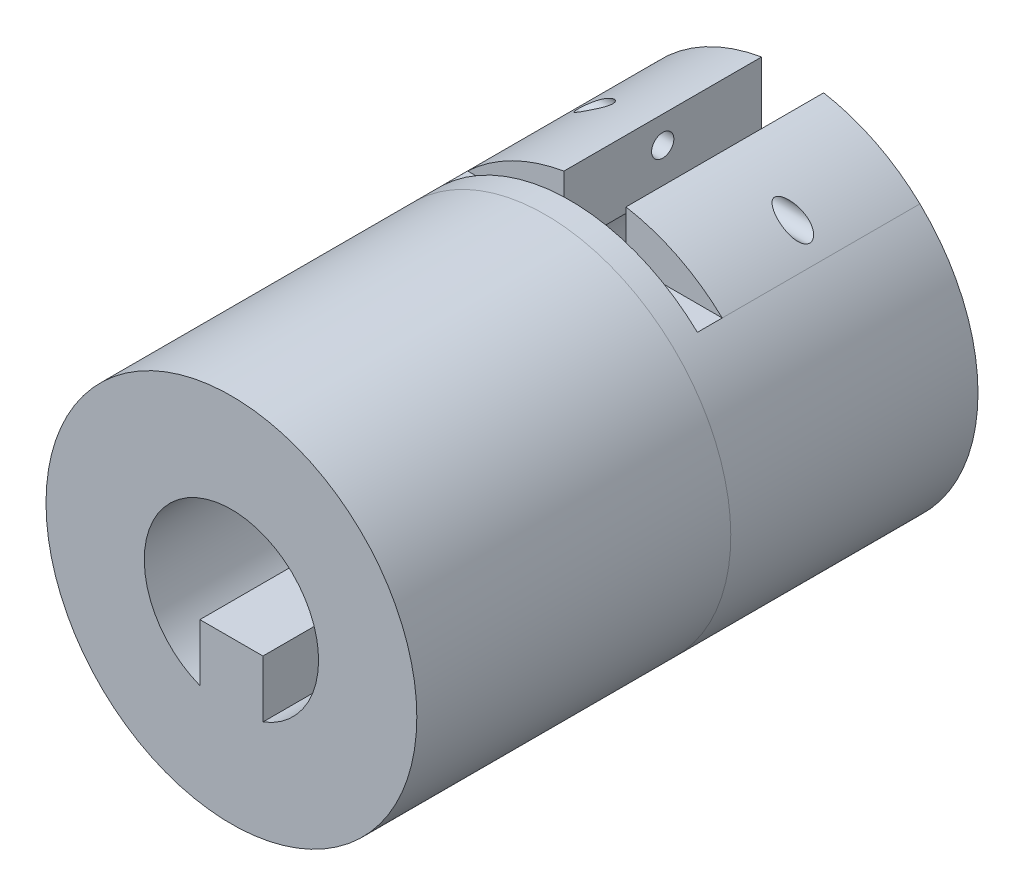
from build123d import *

# Parameters (mm, degrees)
SKETCH1_R               = 15
BOSS_EXTRUDE2_DEPTH     = 25.4
SKETCH11_R              = 15.000115832
BOSS_EXTRUDE3_DEPTH     = 2
BOSS_EXTRUDE4_DEPTH     = 18
SKETCH13_W              = 30.000231663
SKETCH13_H              = 2.007767584
CUT_EXTRUDE1_DEPTH      = 22
CUT_EXTRUDE2_DEPTH      = 40.263306431
CUT_EXTRUDE2_DEPTH_BACK = 40.263306431
SKETCH14_R              = 0.9


with BuildPart() as part:
    # Sketch1 → Boss-Extrude2 (new body)
    with BuildSketch(Plane.XY):
        with Locations((-0.013850499, -10.904093226)):
            Circle(SKETCH1_R)
        with BuildLine():
            Line((2.536149501, -12.854093226), (-2.563850499, -12.854093226))
            Line((-2.563850499, -12.854093226), (-2.563850499, -17.476763916))
            ThreePointArc((-2.563850499, -17.476763916), (-0.013850499, -3.854093226), (2.536149501, -17.476763916))
            Line((2.536149501, -17.476763916), (2.536149501, -12.854093226))
        make_face(mode=Mode.SUBTRACT)
    extrude(amount=BOSS_EXTRUDE2_DEPTH)

    # Sketch11 → Boss-Extrude3 (add)
    with BuildSketch(Plane(origin=(0, 0, 0), x_dir=(-1, 0, 0), z_dir=(0, 0, -1))):
        with Locations((0.013850499, -10.904093226)):
            Circle(SKETCH11_R)
    extrude(amount=BOSS_EXTRUDE3_DEPTH)

    # Sketch12 → Boss-Extrude4 (add)
    with BuildSketch(Plane(origin=(0, 0, -2), x_dir=(-1, 0, 0), z_dir=(0, 0, -1))):
        with BuildLine():
            Line((2.524923405, 3.884347795), (2.524923405, -1.586528477))
            ThreePointArc((2.524923405, -1.586528477), (0.013850499, -20.554093226), (-2.497222408, -1.586528477))
            Line((-2.497222408, -1.586528477), (-2.497222408, 3.884347795))
            ThreePointArc((-2.497222408, 3.884347795), (-9.664400648, -22.364238501), (15.01396633, -10.904093226))
            ThreePointArc((15.01396633, -10.904093226), (11.473995773, -1.22584208), (2.524923405, 3.884347795))
        make_face()
    extrude(amount=BOSS_EXTRUDE4_DEPTH)

    # Sketch13 → Cut-Extrude1 (cut)
    with BuildSketch(Plane(origin=(0, 0, 0), x_dir=(1, 0, 0), z_dir=(0, 1, 0))):
        with Locations((-0.013850499, 3.003883792)):
            Rectangle(SKETCH13_W, SKETCH13_H)
    extrude(amount=CUT_EXTRUDE1_DEPTH, mode=Mode.SUBTRACT)

    # Sketch14 → Cut-Extrude2 (cut, two sides: drawn at the far end of the back side and taken through both)
    with BuildSketch(Plane(origin=(0, 0, 0), x_dir=(0, 0, -1), z_dir=(1, 0, 0)).offset(-CUT_EXTRUDE2_DEPTH_BACK)):
        with Locations((12.003883792, 1.693836615)):
            Circle(SKETCH14_R)
    extrude(amount=CUT_EXTRUDE2_DEPTH + CUT_EXTRUDE2_DEPTH_BACK, mode=Mode.SUBTRACT)


solid = part.part
